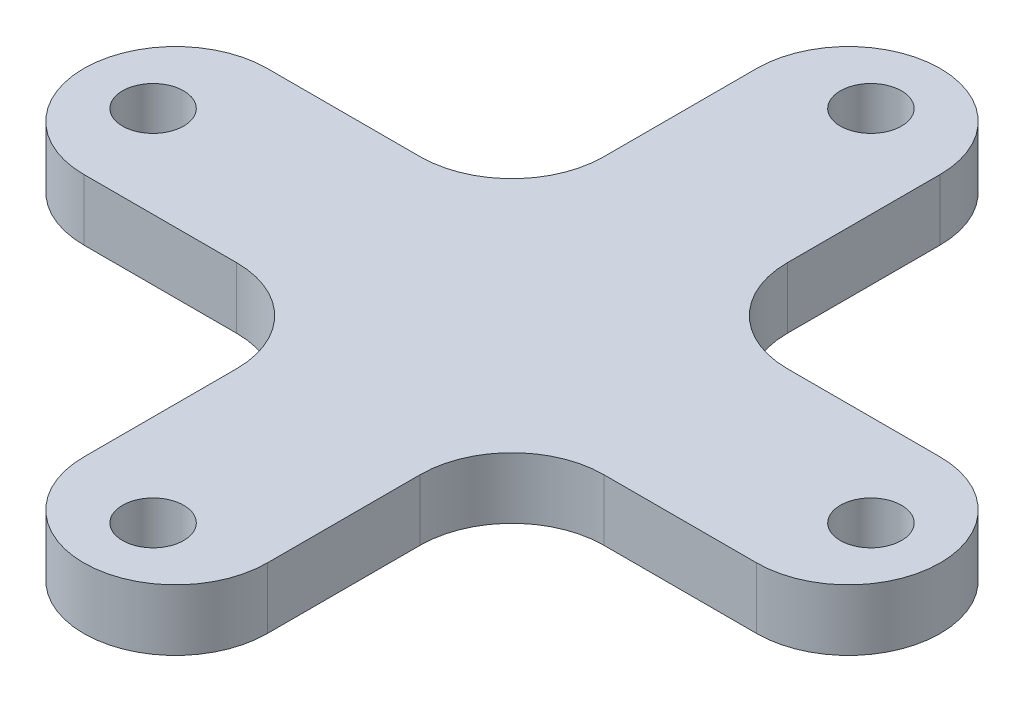
from build123d import *

# Parameters (mm, degrees)
SCHIZZO1_R                   = 2.5
ESTRUSIONE_ESTRUSIONE1_DEPTH = 5


with BuildPart() as part:
    # Schizzo1 → Estrusione-Estrusione1 (new body)
    with BuildSketch(Plane(origin=(0, 0, 0), x_dir=(1, 0, 0), z_dir=(0, 1, 0))):
        with BuildLine():
            Line((-11.689632133, -11.801288053), (-11.689632133, -24.301288053))
            ThreePointArc((-11.689632133, -24.301288053), (-4.189632133, -31.801288053), (3.310367867, -24.301288053))
            Line((3.310367867, -24.301288053), (3.310367867, -11.801288053))
            ThreePointArc((3.310367867, -11.801288053), (5.507067009, -6.497987194), (10.810367867, -4.301288053))
            Line((10.810367867, -4.301288053), (23.310367867, -4.301288053))
            ThreePointArc((23.310367867, -4.301288053), (30.810367867, 3.198711947), (23.310367867, 10.698711947))
            Line((23.310367867, 10.698711947), (10.810367867, 10.698711947))
            ThreePointArc((10.810367867, 10.698711947), (5.507067009, 12.895411089), (3.310367867, 18.198711947))
            Line((3.310367867, 18.198711947), (3.310367867, 30.698711947))
            ThreePointArc((3.310367867, 30.698711947), (-4.189632133, 38.198711947), (-11.689632133, 30.698711947))
            Line((-11.689632133, 30.698711947), (-11.689632133, 18.198711947))
            ThreePointArc((-11.689632133, 18.198711947), (-13.886331274, 12.895411089), (-19.189632133, 10.698711947))
            Line((-19.189632133, 10.698711947), (-31.689632133, 10.698711947))
            ThreePointArc((-31.689632133, 10.698711947), (-39.189632133, 3.198711947), (-31.689632133, -4.301288053))
            Line((-31.689632133, -4.301288053), (-19.189632133, -4.301288053))
            ThreePointArc((-19.189632133, -4.301288053), (-13.886331274, -6.497987194), (-11.689632133, -11.801288053))
        make_face()
        with Locations((25.145367867, 3.198707885)):
            Circle(SCHIZZO1_R, mode=Mode.SUBTRACT)
        with Locations((-33.524632133, 3.198707885)):
            Circle(SCHIZZO1_R, mode=Mode.SUBTRACT)
        with Locations((-4.189632133, 32.533707885)):
            Circle(SCHIZZO1_R, mode=Mode.SUBTRACT)
        with Locations((-4.189632133, -26.136292115)):
            Circle(SCHIZZO1_R, mode=Mode.SUBTRACT)
    extrude(amount=ESTRUSIONE_ESTRUSIONE1_DEPTH)


solid = part.part
